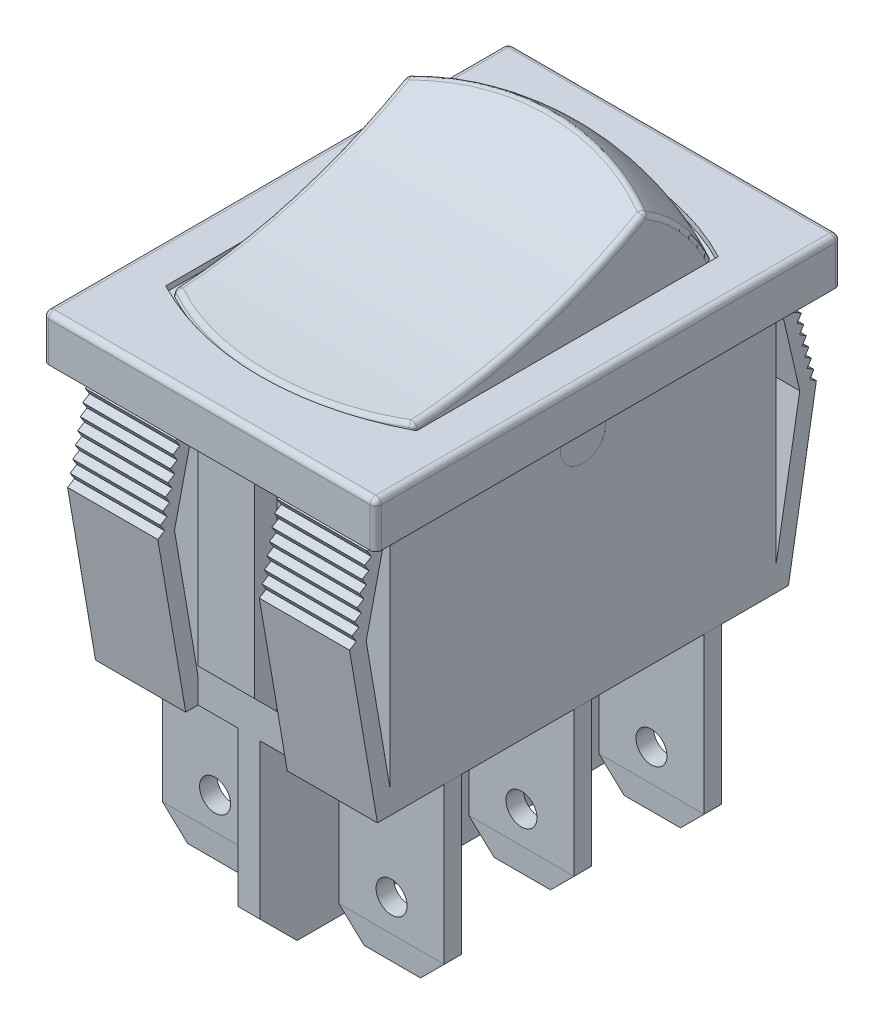
from build123d import *

# Parameters (mm, degrees)
SKETCH1_W             = 14.986
SKETCH1_H             = 20.955
BOSS_EXTRUDE1_DEPTH   = 2.032
SKETCH2_W             = 12.7
SKETCH2_H             = 17.399
BOSS_EXTRUDE2_DEPTH   = 11.684
BOSS_EXTRUDE4_DEPTH   = 4.064
CUT_EXTRUDE1_REACH    = 22.946
LPATTERN1_COUNT       = 8
LPATTERN1_PITCH       = 0.508
MIRROR2_COPY_1_REACH  = 22.946
MIRROR2_COPY_2_REACH  = 22.946
MIRROR2_COPY_3_REACH  = 22.946
MIRROR2_COPY_4_REACH  = 22.946
MIRROR2_COPY_5_REACH  = 22.946
MIRROR2_COPY_6_REACH  = 22.946
MIRROR2_COPY_7_REACH  = 22.946
BOSS_EXTRUDE5_DEPTH   = 1.27
MIRROR3_COPY_1_REACH  = 22.946
MIRROR3_COPY_2_REACH  = 22.946
MIRROR3_COPY_3_REACH  = 22.946
MIRROR3_COPY_4_REACH  = 22.946
MIRROR3_COPY_5_REACH  = 22.946
MIRROR3_COPY_6_REACH  = 22.946
MIRROR3_COPY_7_REACH  = 22.946
MIRROR3_COPY_8_DEPTH  = 4.064
MIRROR3_COPY_9_REACH  = 22.946
MIRROR3_COPY_10_REACH = 22.946
MIRROR3_COPY_11_REACH = 22.946
MIRROR3_COPY_12_REACH = 22.946
MIRROR3_COPY_13_REACH = 22.946
MIRROR3_COPY_14_REACH = 22.946
MIRROR3_COPY_15_REACH = 22.946
MIRROR3_COPY_16_REACH = 22.946
SKETCH9_W             = 0.9906
SKETCH9_H             = 17.399
BOSS_EXTRUDE6_DEPTH   = 8.636
CUT_EXTRUDE2_REACH    = 26.234
SKETCH11_W            = 4.7498
SKETCH11_H            = 0.7874
BOSS_EXTRUDE7_DEPTH   = 8.128
CUT_EXTRUDE3_REACH    = 28.913
SKETCH12_R            = 0.6985
SKETCH13_W            = 4.7498
SKETCH13_H            = 0.7874
BOSS_EXTRUDE8_DEPTH   = 7.62
CUT_EXTRUDE4_REACH    = 26.25
SKETCH14_R            = 0.6985
CUT_EXTRUDE5_REACH    = 28.742
CUT_EXTRUDE6_DEPTH    = 0.254
SKETCH18_R            = 1.016
CUT_EXTRUDE7_DEPTH    = 12.7
CUT_EXTRUDE8_DEPTH    = 10.795
FILLET2_R             = 0.254
FILLET3_R             = 0.254
SKETCH22_W            = 12.4968
SKETCH22_H            = 7.0231
CUT_EXTRUDE9_DEPTH    = 0.00254


# Read off the part's stored shape, not the designer's step: Mirror5
with BuildPart() as part:
    # Sketch1 → Boss-Extrude1 (new body)
    with BuildSketch(Plane(origin=(0, 0, 0), x_dir=(1, 0, 0), z_dir=(0, 1, 0))):
        Rectangle(SKETCH1_W, SKETCH1_H)
    extrude(amount=BOSS_EXTRUDE1_DEPTH)

    # Sketch2 → Boss-Extrude2 (add)
    with BuildSketch(Plane.XZ):
        Rectangle(SKETCH2_W, SKETCH2_H)
    extrude(amount=BOSS_EXTRUDE2_DEPTH)

    # Sketch5 → Boss-Extrude4 (add)
    with BuildSketch(Plane(origin=(6.35, 0, 0), x_dir=(0, 0, -1), z_dir=(1, 0, 0))):
        Polygon((-9.525, 0), (-10.5156, -4.318), (-9.2583, -11.684), (-8.6995, -11.684), (-8.6995, -10.579929775), (-9.764728233, -4.339198711), (-8.769265, 0), align=None)
    boss_extrude4 = extrude(amount=-BOSS_EXTRUDE4_DEPTH)

    # Sketch6 → Cut-Extrude1 (cut, up to next)
    with BuildSketch(Plane(origin=(6.35, 0, 0), x_dir=(0, 0, -1), z_dir=(1, 0, 0)), mode=Mode.PRIVATE) as cut_extrude1_sk1:
        Polygon((-10.5156, -4.318), (-10.211236016, -4.127226403), (-10.402009614, -3.822862419), align=None)
    cut_extrude1_tool1 = extrude(cut_extrude1_sk1.sketch, amount=-CUT_EXTRUDE1_REACH, mode=Mode.PRIVATE) & part.part
    cut_extrude1 = cut_extrude1_tool1.solids().sort_by_distance((6.35, -4.089363, 10.376282))[0]
    add(cut_extrude1, mode=Mode.SUBTRACT)

    # LPattern1: Cut-Extrude1 ×8
    with Locations(*[Vector(0, 0.9746802776302901, -0.22360312251518483) * (i * LPATTERN1_PITCH) for i in range(1, LPATTERN1_COUNT)]):
        add(cut_extrude1, mode=Mode.SUBTRACT)

    # Mirror2: Boss-Extrude4, Cut-Extrude1 across plane
    add(boss_extrude4.mirror(Plane(origin=(0, 0, 0), x_dir=(0, 0, 1), z_dir=(1, 0, 0))))
    add(cut_extrude1.mirror(Plane(origin=(0, 0, 0), x_dir=(0, 0, 1), z_dir=(1, 0, 0))), mode=Mode.SUBTRACT)

    # Mirror2 copy 1 sketch → Mirror2 copy 1 (cut, up to next)
    with BuildSketch(Plane(origin=(-6.35, 0.495137581, -0.113590386), x_dir=(0, 0, -1), z_dir=(-1, 0, 0)), mode=Mode.PRIVATE) as mirror2_copy_1_sk1:
        Polygon((-10.5156, 4.318), (-10.211236016, 4.127226403), (-10.402009614, 3.822862419), align=None)
    mirror2_copy_1_tool1 = extrude(mirror2_copy_1_sk1.sketch, amount=-MIRROR2_COPY_1_REACH, mode=Mode.PRIVATE) & part.part
    add(mirror2_copy_1_tool1.solids().sort_by_distance((-6.35, -3.594225419, 10.262691614))[0], mode=Mode.SUBTRACT)

    # Mirror2 copy 2 sketch → Mirror2 copy 2 (cut, up to next)
    with BuildSketch(Plane(origin=(-6.35, 0.990275162, -0.227180772), x_dir=(0, 0, -1), z_dir=(-1, 0, 0)), mode=Mode.PRIVATE) as mirror2_copy_2_sk1:
        Polygon((-10.5156, 4.318), (-10.211236016, 4.127226403), (-10.402009614, 3.822862419), align=None)
    mirror2_copy_2_tool1 = extrude(mirror2_copy_2_sk1.sketch, amount=-MIRROR2_COPY_2_REACH, mode=Mode.PRIVATE) & part.part
    add(mirror2_copy_2_tool1.solids().sort_by_distance((-6.35, -3.099087838, 10.149101228))[0], mode=Mode.SUBTRACT)

    # Mirror2 copy 3 sketch → Mirror2 copy 3 (cut, up to next)
    with BuildSketch(Plane(origin=(-6.35, 1.485412743, -0.340771159), x_dir=(0, 0, -1), z_dir=(-1, 0, 0)), mode=Mode.PRIVATE) as mirror2_copy_3_sk1:
        Polygon((-10.5156, 4.318), (-10.211236016, 4.127226403), (-10.402009614, 3.822862419), align=None)
    mirror2_copy_3_tool1 = extrude(mirror2_copy_3_sk1.sketch, amount=-MIRROR2_COPY_3_REACH, mode=Mode.PRIVATE) & part.part
    add(mirror2_copy_3_tool1.solids().sort_by_distance((-6.35, -2.603950257, 10.035510841))[0], mode=Mode.SUBTRACT)

    # Mirror2 copy 4 sketch → Mirror2 copy 4 (cut, up to next)
    with BuildSketch(Plane(origin=(-6.35, 1.980550324, -0.454361545), x_dir=(0, 0, -1), z_dir=(-1, 0, 0)), mode=Mode.PRIVATE) as mirror2_copy_4_sk1:
        Polygon((-10.5156, 4.318), (-10.211236016, 4.127226403), (-10.402009614, 3.822862419), align=None)
    mirror2_copy_4_tool1 = extrude(mirror2_copy_4_sk1.sketch, amount=-MIRROR2_COPY_4_REACH, mode=Mode.PRIVATE) & part.part
    add(mirror2_copy_4_tool1.solids().sort_by_distance((-6.35, -2.108812676, 9.921920455))[0], mode=Mode.SUBTRACT)

    # Mirror2 copy 5 sketch → Mirror2 copy 5 (cut, up to next)
    with BuildSketch(Plane(origin=(-6.35, 2.475687905, -0.567951931), x_dir=(0, 0, -1), z_dir=(-1, 0, 0)), mode=Mode.PRIVATE) as mirror2_copy_5_sk1:
        Polygon((-10.5156, 4.318), (-10.211236016, 4.127226403), (-10.402009614, 3.822862419), align=None)
    mirror2_copy_5_tool1 = extrude(mirror2_copy_5_sk1.sketch, amount=-MIRROR2_COPY_5_REACH, mode=Mode.PRIVATE) & part.part
    add(mirror2_copy_5_tool1.solids().sort_by_distance((-6.35, -1.613675095, 9.808330069))[0], mode=Mode.SUBTRACT)

    # Mirror2 copy 6 sketch → Mirror2 copy 6 (cut, up to next)
    with BuildSketch(Plane(origin=(-6.35, 2.970825486, -0.681542317), x_dir=(0, 0, -1), z_dir=(-1, 0, 0)), mode=Mode.PRIVATE) as mirror2_copy_6_sk1:
        Polygon((-10.5156, 4.318), (-10.211236016, 4.127226403), (-10.402009614, 3.822862419), align=None)
    mirror2_copy_6_tool1 = extrude(mirror2_copy_6_sk1.sketch, amount=-MIRROR2_COPY_6_REACH, mode=Mode.PRIVATE) & part.part
    add(mirror2_copy_6_tool1.solids().sort_by_distance((-6.35, -1.118537514, 9.694739683))[0], mode=Mode.SUBTRACT)

    # Mirror2 copy 7 sketch → Mirror2 copy 7 (cut, up to next)
    with BuildSketch(Plane(origin=(-6.35, 3.465963067, -0.795132704), x_dir=(0, 0, -1), z_dir=(-1, 0, 0)), mode=Mode.PRIVATE) as mirror2_copy_7_sk1:
        Polygon((-10.5156, 4.318), (-10.211236016, 4.127226403), (-10.402009614, 3.822862419), align=None)
    mirror2_copy_7_tool1 = extrude(mirror2_copy_7_sk1.sketch, amount=-MIRROR2_COPY_7_REACH, mode=Mode.PRIVATE) & part.part
    add(mirror2_copy_7_tool1.solids().sort_by_distance((-6.35, -0.623399933, 9.581149296))[0], mode=Mode.SUBTRACT)

    # Sketch8 → Boss-Extrude5 (add, symmetric)
    with BuildSketch(Plane(origin=(0, 0, 0), x_dir=(0, 0, -1), z_dir=(1, 0, 0))):
        Polygon((-9.7155, 0), (-8.6995, 0), (-8.6995, -10.16), (-9.7155, -9.144), align=None)
    boss_extrude5 = extrude(amount=BOSS_EXTRUDE5_DEPTH, both=True)

    # Mirror3: Boss-Extrude4, Cut-Extrude1, Boss-Extrude5 across plane
    add(boss_extrude4.mirror(Plane.XY))
    add(cut_extrude1.mirror(Plane.XY), mode=Mode.SUBTRACT)
    add(boss_extrude5.mirror(Plane.XY))

    # Mirror3 copy 1 sketch → Mirror3 copy 1 (cut, up to next)
    with BuildSketch(Plane(origin=(6.35, 0.495137581, 0.113590386), x_dir=(0, 0, 1), z_dir=(1, 0, 0)), mode=Mode.PRIVATE) as mirror3_copy_1_sk1:
        Polygon((-10.5156, 4.318), (-10.211236016, 4.127226403), (-10.402009614, 3.822862419), align=None)
    mirror3_copy_1_tool1 = extrude(mirror3_copy_1_sk1.sketch, amount=-MIRROR3_COPY_1_REACH, mode=Mode.PRIVATE) & part.part
    add(mirror3_copy_1_tool1.solids().sort_by_distance((6.35, -3.594225419, -10.262691614))[0], mode=Mode.SUBTRACT)

    # Mirror3 copy 2 sketch → Mirror3 copy 2 (cut, up to next)
    with BuildSketch(Plane(origin=(6.35, 0.990275162, 0.227180772), x_dir=(0, 0, 1), z_dir=(1, 0, 0)), mode=Mode.PRIVATE) as mirror3_copy_2_sk1:
        Polygon((-10.5156, 4.318), (-10.211236016, 4.127226403), (-10.402009614, 3.822862419), align=None)
    mirror3_copy_2_tool1 = extrude(mirror3_copy_2_sk1.sketch, amount=-MIRROR3_COPY_2_REACH, mode=Mode.PRIVATE) & part.part
    add(mirror3_copy_2_tool1.solids().sort_by_distance((6.35, -3.099087838, -10.149101228))[0], mode=Mode.SUBTRACT)

    # Mirror3 copy 3 sketch → Mirror3 copy 3 (cut, up to next)
    with BuildSketch(Plane(origin=(6.35, 1.485412743, 0.340771159), x_dir=(0, 0, 1), z_dir=(1, 0, 0)), mode=Mode.PRIVATE) as mirror3_copy_3_sk1:
        Polygon((-10.5156, 4.318), (-10.211236016, 4.127226403), (-10.402009614, 3.822862419), align=None)
    mirror3_copy_3_tool1 = extrude(mirror3_copy_3_sk1.sketch, amount=-MIRROR3_COPY_3_REACH, mode=Mode.PRIVATE) & part.part
    add(mirror3_copy_3_tool1.solids().sort_by_distance((6.35, -2.603950257, -10.035510841))[0], mode=Mode.SUBTRACT)

    # Mirror3 copy 4 sketch → Mirror3 copy 4 (cut, up to next)
    with BuildSketch(Plane(origin=(6.35, 1.980550324, 0.454361545), x_dir=(0, 0, 1), z_dir=(1, 0, 0)), mode=Mode.PRIVATE) as mirror3_copy_4_sk1:
        Polygon((-10.5156, 4.318), (-10.211236016, 4.127226403), (-10.402009614, 3.822862419), align=None)
    mirror3_copy_4_tool1 = extrude(mirror3_copy_4_sk1.sketch, amount=-MIRROR3_COPY_4_REACH, mode=Mode.PRIVATE) & part.part
    add(mirror3_copy_4_tool1.solids().sort_by_distance((6.35, -2.108812676, -9.921920455))[0], mode=Mode.SUBTRACT)

    # Mirror3 copy 5 sketch → Mirror3 copy 5 (cut, up to next)
    with BuildSketch(Plane(origin=(6.35, 2.475687905, 0.567951931), x_dir=(0, 0, 1), z_dir=(1, 0, 0)), mode=Mode.PRIVATE) as mirror3_copy_5_sk1:
        Polygon((-10.5156, 4.318), (-10.211236016, 4.127226403), (-10.402009614, 3.822862419), align=None)
    mirror3_copy_5_tool1 = extrude(mirror3_copy_5_sk1.sketch, amount=-MIRROR3_COPY_5_REACH, mode=Mode.PRIVATE) & part.part
    add(mirror3_copy_5_tool1.solids().sort_by_distance((6.35, -1.613675095, -9.808330069))[0], mode=Mode.SUBTRACT)

    # Mirror3 copy 6 sketch → Mirror3 copy 6 (cut, up to next)
    with BuildSketch(Plane(origin=(6.35, 2.970825486, 0.681542317), x_dir=(0, 0, 1), z_dir=(1, 0, 0)), mode=Mode.PRIVATE) as mirror3_copy_6_sk1:
        Polygon((-10.5156, 4.318), (-10.211236016, 4.127226403), (-10.402009614, 3.822862419), align=None)
    mirror3_copy_6_tool1 = extrude(mirror3_copy_6_sk1.sketch, amount=-MIRROR3_COPY_6_REACH, mode=Mode.PRIVATE) & part.part
    add(mirror3_copy_6_tool1.solids().sort_by_distance((6.35, -1.118537514, -9.694739683))[0], mode=Mode.SUBTRACT)

    # Mirror3 copy 7 sketch → Mirror3 copy 7 (cut, up to next)
    with BuildSketch(Plane(origin=(6.35, 3.465963067, 0.795132704), x_dir=(0, 0, 1), z_dir=(1, 0, 0)), mode=Mode.PRIVATE) as mirror3_copy_7_sk1:
        Polygon((-10.5156, 4.318), (-10.211236016, 4.127226403), (-10.402009614, 3.822862419), align=None)
    mirror3_copy_7_tool1 = extrude(mirror3_copy_7_sk1.sketch, amount=-MIRROR3_COPY_7_REACH, mode=Mode.PRIVATE) & part.part
    add(mirror3_copy_7_tool1.solids().sort_by_distance((6.35, -0.623399933, -9.581149296))[0], mode=Mode.SUBTRACT)

    # Mirror3 copy 8 sketch → Mirror3 copy 8 (add)
    with BuildSketch(Plane.ZY.offset(6.35)):
        Polygon((-9.525, 0), (-10.5156, -4.318), (-9.2583, -11.684), (-8.6995, -11.684), (-8.6995, -10.579929775), (-9.764728233, -4.339198711), (-8.769265, 0), align=None)
    extrude(amount=-MIRROR3_COPY_8_DEPTH)

    # Mirror3 copy 9 sketch → Mirror3 copy 9 (cut, up to next)
    with BuildSketch(Plane.ZY.offset(6.35), mode=Mode.PRIVATE) as mirror3_copy_9_sk1:
        Polygon((-10.5156, -4.318), (-10.211236016, -4.127226403), (-10.402009614, -3.822862419), align=None)
    mirror3_copy_9_tool1 = extrude(mirror3_copy_9_sk1.sketch, amount=-MIRROR3_COPY_9_REACH, mode=Mode.PRIVATE) & part.part
    add(mirror3_copy_9_tool1.solids().sort_by_distance((-6.35, -4.089363, -10.376282))[0], mode=Mode.SUBTRACT)

    # Mirror3 copy 10 sketch → Mirror3 copy 10 (cut, up to next)
    with BuildSketch(Plane(origin=(-6.35, 0.495137581, 0.113590386), x_dir=(0, 0, 1), z_dir=(-1, 0, 0)), mode=Mode.PRIVATE) as mirror3_copy_10_sk1:
        Polygon((-10.5156, -4.318), (-10.211236016, -4.127226403), (-10.402009614, -3.822862419), align=None)
    mirror3_copy_10_tool1 = extrude(mirror3_copy_10_sk1.sketch, amount=-MIRROR3_COPY_10_REACH, mode=Mode.PRIVATE) & part.part
    add(mirror3_copy_10_tool1.solids().sort_by_distance((-6.35, -3.594225419, -10.262691614))[0], mode=Mode.SUBTRACT)

    # Mirror3 copy 11 sketch → Mirror3 copy 11 (cut, up to next)
    with BuildSketch(Plane(origin=(-6.35, 0.990275162, 0.227180772), x_dir=(0, 0, 1), z_dir=(-1, 0, 0)), mode=Mode.PRIVATE) as mirror3_copy_11_sk1:
        Polygon((-10.5156, -4.318), (-10.211236016, -4.127226403), (-10.402009614, -3.822862419), align=None)
    mirror3_copy_11_tool1 = extrude(mirror3_copy_11_sk1.sketch, amount=-MIRROR3_COPY_11_REACH, mode=Mode.PRIVATE) & part.part
    add(mirror3_copy_11_tool1.solids().sort_by_distance((-6.35, -3.099087838, -10.149101228))[0], mode=Mode.SUBTRACT)

    # Mirror3 copy 12 sketch → Mirror3 copy 12 (cut, up to next)
    with BuildSketch(Plane(origin=(-6.35, 1.485412743, 0.340771159), x_dir=(0, 0, 1), z_dir=(-1, 0, 0)), mode=Mode.PRIVATE) as mirror3_copy_12_sk1:
        Polygon((-10.5156, -4.318), (-10.211236016, -4.127226403), (-10.402009614, -3.822862419), align=None)
    mirror3_copy_12_tool1 = extrude(mirror3_copy_12_sk1.sketch, amount=-MIRROR3_COPY_12_REACH, mode=Mode.PRIVATE) & part.part
    add(mirror3_copy_12_tool1.solids().sort_by_distance((-6.35, -2.603950257, -10.035510841))[0], mode=Mode.SUBTRACT)

    # Mirror3 copy 13 sketch → Mirror3 copy 13 (cut, up to next)
    with BuildSketch(Plane(origin=(-6.35, 1.980550324, 0.454361545), x_dir=(0, 0, 1), z_dir=(-1, 0, 0)), mode=Mode.PRIVATE) as mirror3_copy_13_sk1:
        Polygon((-10.5156, -4.318), (-10.211236016, -4.127226403), (-10.402009614, -3.822862419), align=None)
    mirror3_copy_13_tool1 = extrude(mirror3_copy_13_sk1.sketch, amount=-MIRROR3_COPY_13_REACH, mode=Mode.PRIVATE) & part.part
    add(mirror3_copy_13_tool1.solids().sort_by_distance((-6.35, -2.108812676, -9.921920455))[0], mode=Mode.SUBTRACT)

    # Mirror3 copy 14 sketch → Mirror3 copy 14 (cut, up to next)
    with BuildSketch(Plane(origin=(-6.35, 2.475687905, 0.567951931), x_dir=(0, 0, 1), z_dir=(-1, 0, 0)), mode=Mode.PRIVATE) as mirror3_copy_14_sk1:
        Polygon((-10.5156, -4.318), (-10.211236016, -4.127226403), (-10.402009614, -3.822862419), align=None)
    mirror3_copy_14_tool1 = extrude(mirror3_copy_14_sk1.sketch, amount=-MIRROR3_COPY_14_REACH, mode=Mode.PRIVATE) & part.part
    add(mirror3_copy_14_tool1.solids().sort_by_distance((-6.35, -1.613675095, -9.808330069))[0], mode=Mode.SUBTRACT)

    # Mirror3 copy 15 sketch → Mirror3 copy 15 (cut, up to next)
    with BuildSketch(Plane(origin=(-6.35, 2.970825486, 0.681542317), x_dir=(0, 0, 1), z_dir=(-1, 0, 0)), mode=Mode.PRIVATE) as mirror3_copy_15_sk1:
        Polygon((-10.5156, -4.318), (-10.211236016, -4.127226403), (-10.402009614, -3.822862419), align=None)
    mirror3_copy_15_tool1 = extrude(mirror3_copy_15_sk1.sketch, amount=-MIRROR3_COPY_15_REACH, mode=Mode.PRIVATE) & part.part
    add(mirror3_copy_15_tool1.solids().sort_by_distance((-6.35, -1.118537514, -9.694739683))[0], mode=Mode.SUBTRACT)

    # Mirror3 copy 16 sketch → Mirror3 copy 16 (cut, up to next)
    with BuildSketch(Plane(origin=(-6.35, 3.465963067, 0.795132704), x_dir=(0, 0, 1), z_dir=(-1, 0, 0)), mode=Mode.PRIVATE) as mirror3_copy_16_sk1:
        Polygon((-10.5156, -4.318), (-10.211236016, -4.127226403), (-10.402009614, -3.822862419), align=None)
    mirror3_copy_16_tool1 = extrude(mirror3_copy_16_sk1.sketch, amount=-MIRROR3_COPY_16_REACH, mode=Mode.PRIVATE) & part.part
    add(mirror3_copy_16_tool1.solids().sort_by_distance((-6.35, -0.623399933, -9.581149296))[0], mode=Mode.SUBTRACT)

    # Sketch9 → Boss-Extrude6 (add)
    with BuildSketch(Plane.XZ.offset(11.684)):
        Rectangle(SKETCH9_W, SKETCH9_H)
    extrude(amount=BOSS_EXTRUDE6_DEPTH)

    # Sketch10 → Cut-Extrude2 (cut, up to next)
    with BuildSketch(Plane(origin=(0.4953, 0, 0), x_dir=(0, 0, -1), z_dir=(1, 0, 0)), mode=Mode.PRIVATE) as cut_extrude2_sk1:
        Polygon((-8.6995, -18.6436), (-8.6995, -20.32), (-7.0231, -20.32), align=None)
    cut_extrude2_tool1 = extrude(cut_extrude2_sk1.sketch, amount=-CUT_EXTRUDE2_REACH, mode=Mode.PRIVATE) & part.part
    # Sketch10 → Cut-Extrude2 (cut, up to next)
    with BuildSketch(Plane(origin=(0.4953, 0, 0), x_dir=(0, 0, -1), z_dir=(1, 0, 0)), mode=Mode.PRIVATE) as cut_extrude2_sk2:
        Polygon((7.0231, -20.32), (8.6995, -18.6436), (8.6995, -20.32), align=None)
    cut_extrude2_tool2 = extrude(cut_extrude2_sk2.sketch, amount=-CUT_EXTRUDE2_REACH, mode=Mode.PRIVATE) & part.part
    add(cut_extrude2_tool1.solids().sort_by_distance((0.4953, -19.7612, 8.1407))[0], mode=Mode.SUBTRACT)
    add(cut_extrude2_tool2.solids().sort_by_distance((0.4953, -19.7612, -8.1407))[0], mode=Mode.SUBTRACT)

    # Sketch11 → Boss-Extrude7 (add)
    with BuildSketch(Plane.XZ.offset(11.684)):
        with Locations((3.9751, 5.8547)):
            Rectangle(SKETCH11_W, SKETCH11_H)
    boss_extrude7 = extrude(amount=BOSS_EXTRUDE7_DEPTH)

    # Sketch12 → Cut-Extrude3 (cut, up to next)
    with BuildSketch(Plane(origin=(0, 0, 5.461), x_dir=(-1, 0, 0), z_dir=(0, 0, -1)), mode=Mode.PRIVATE) as cut_extrude3_sk1:
        with Locations((-3.9751, -17.272)):
            Circle(SKETCH12_R)
    cut_extrude3_tool1 = extrude(cut_extrude3_sk1.sketch, amount=-CUT_EXTRUDE3_REACH, mode=Mode.PRIVATE) & part.part
    # Sketch12 → Cut-Extrude3 (cut, up to next)
    with BuildSketch(Plane(origin=(0, 0, 5.461), x_dir=(-1, 0, 0), z_dir=(0, 0, -1)), mode=Mode.PRIVATE) as cut_extrude3_sk2:
        Polygon((-1.6002, -18.7071), (-2.7051, -19.812), (-1.6002, -19.812), align=None)
    cut_extrude3_tool2 = extrude(cut_extrude3_sk2.sketch, amount=-CUT_EXTRUDE3_REACH, mode=Mode.PRIVATE) & part.part
    # Sketch12 → Cut-Extrude3 (cut, up to next)
    with BuildSketch(Plane(origin=(0, 0, 5.461), x_dir=(-1, 0, 0), z_dir=(0, 0, -1)), mode=Mode.PRIVATE) as cut_extrude3_sk3:
        Polygon((-5.2451, -19.812), (-6.35, -19.812), (-6.35, -18.7071), align=None)
    cut_extrude3_tool3 = extrude(cut_extrude3_sk3.sketch, amount=-CUT_EXTRUDE3_REACH, mode=Mode.PRIVATE) & part.part
    cut_extrude3_1 = cut_extrude3_tool1.solids().sort_by_distance((3.9751, -17.272, 5.461))[0]
    add(cut_extrude3_1, mode=Mode.SUBTRACT)
    cut_extrude3_2 = cut_extrude3_tool2.solids().sort_by_distance((1.9685, -19.4437, 5.461))[0]
    add(cut_extrude3_2, mode=Mode.SUBTRACT)
    cut_extrude3_3 = cut_extrude3_tool3.solids().sort_by_distance((5.9817, -19.4437, 5.461))[0]
    add(cut_extrude3_3, mode=Mode.SUBTRACT)
    cut_extrude3 = cut_extrude3_1 + cut_extrude3_2 + cut_extrude3_3  # Cut-Extrude3 as one shape, for the pattern or mirror that repeats it

    # Mirror4: Boss-Extrude7, Cut-Extrude3 across plane
    add(boss_extrude7.mirror(Plane.XY))
    add(cut_extrude3.mirror(Plane.XY), mode=Mode.SUBTRACT)

    # Sketch13 → Boss-Extrude8 (add)
    with BuildSketch(Plane.XZ.offset(11.684)):
        with Locations((3.9751, 0)):
            Rectangle(SKETCH13_W, SKETCH13_H)
    extrude(amount=BOSS_EXTRUDE8_DEPTH)

    # Sketch14 → Cut-Extrude4 (cut, up to next)
    with BuildSketch(Plane(origin=(0, 0, -0.3937), x_dir=(-1, 0, 0), z_dir=(0, 0, -1)), mode=Mode.PRIVATE) as cut_extrude4_sk1:
        with Locations((-3.9751, -16.764)):
            Circle(SKETCH14_R)
    cut_extrude4_tool1 = extrude(cut_extrude4_sk1.sketch, amount=-CUT_EXTRUDE4_REACH, mode=Mode.PRIVATE) & part.part
    # Sketch14 → Cut-Extrude4 (cut, up to next)
    with BuildSketch(Plane(origin=(0, 0, -0.3937), x_dir=(-1, 0, 0), z_dir=(0, 0, -1)), mode=Mode.PRIVATE) as cut_extrude4_sk2:
        Polygon((-5.2451, -19.304), (-6.35, -19.304), (-6.35, -18.1991), align=None)
    cut_extrude4_tool2 = extrude(cut_extrude4_sk2.sketch, amount=-CUT_EXTRUDE4_REACH, mode=Mode.PRIVATE) & part.part
    # Sketch14 → Cut-Extrude4 (cut, up to next)
    with BuildSketch(Plane(origin=(0, 0, -0.3937), x_dir=(-1, 0, 0), z_dir=(0, 0, -1)), mode=Mode.PRIVATE) as cut_extrude4_sk3:
        Polygon((-1.6002, -18.1991), (-2.7051, -19.304), (-1.6002, -19.304), align=None)
    cut_extrude4_tool3 = extrude(cut_extrude4_sk3.sketch, amount=-CUT_EXTRUDE4_REACH, mode=Mode.PRIVATE) & part.part
    add(cut_extrude4_tool1.solids().sort_by_distance((3.9751, -16.764, -0.3937))[0], mode=Mode.SUBTRACT)
    add(cut_extrude4_tool2.solids().sort_by_distance((5.9817, -18.9357, -0.3937))[0], mode=Mode.SUBTRACT)
    add(cut_extrude4_tool3.solids().sort_by_distance((1.9685, -18.9357, -0.3937))[0], mode=Mode.SUBTRACT)

    # Cut-Extrude5: up to this face of the body (flat: up to its plane)
    cut_extrude5_end = Plane(part.part.faces().sort_by_distance((1.6002, -15.19555, -5.8547))[0])
    # Sketch15 → Cut-Extrude5 (cut, up to the picked face)
    with BuildSketch(Plane(origin=(6.35, 0, 0), x_dir=(0, 0, -1), z_dir=(1, 0, 0)), mode=Mode.PRIVATE) as cut_extrude5_sk1:
        Polygon((6.2484, -18.7071), (6.2103, -19.812), (6.2484, -19.812), align=None)
    cut_extrude5_tool1 = split(extrude(cut_extrude5_sk1.sketch, amount=-CUT_EXTRUDE5_REACH, mode=Mode.PRIVATE), bisect_by=cut_extrude5_end, keep=Keep.BOTH, mode=Mode.PRIVATE)
    # Sketch15 → Cut-Extrude5 (cut, up to the picked face)
    with BuildSketch(Plane(origin=(6.35, 0, 0), x_dir=(0, 0, -1), z_dir=(1, 0, 0)), mode=Mode.PRIVATE) as cut_extrude5_sk2:
        Polygon((0.3937, -18.1991), (0.3556, -19.304), (0.3937, -19.304), align=None)
    cut_extrude5_tool2 = split(extrude(cut_extrude5_sk2.sketch, amount=-CUT_EXTRUDE5_REACH, mode=Mode.PRIVATE), bisect_by=cut_extrude5_end, keep=Keep.BOTH, mode=Mode.PRIVATE)
    # Sketch15 → Cut-Extrude5 (cut, up to the picked face)
    with BuildSketch(Plane(origin=(6.35, 0, 0), x_dir=(0, 0, -1), z_dir=(1, 0, 0)), mode=Mode.PRIVATE) as cut_extrude5_sk3:
        Polygon((-5.461, -18.7071), (-5.4991, -19.812), (-5.461, -19.812), align=None)
    cut_extrude5_tool3 = split(extrude(cut_extrude5_sk3.sketch, amount=-CUT_EXTRUDE5_REACH, mode=Mode.PRIVATE), bisect_by=cut_extrude5_end, keep=Keep.BOTH, mode=Mode.PRIVATE)
    # Sketch15 → Cut-Extrude5 (cut, up to the picked face)
    with BuildSketch(Plane(origin=(6.35, 0, 0), x_dir=(0, 0, -1), z_dir=(1, 0, 0)), mode=Mode.PRIVATE) as cut_extrude5_sk4:
        Polygon((5.461, -19.812), (5.461, -18.7071), (5.4991, -19.812), align=None)
    cut_extrude5_tool4 = split(extrude(cut_extrude5_sk4.sketch, amount=-CUT_EXTRUDE5_REACH, mode=Mode.PRIVATE), bisect_by=cut_extrude5_end, keep=Keep.BOTH, mode=Mode.PRIVATE)
    # Sketch15 → Cut-Extrude5 (cut, up to the picked face)
    with BuildSketch(Plane(origin=(6.35, 0, 0), x_dir=(0, 0, -1), z_dir=(1, 0, 0)), mode=Mode.PRIVATE) as cut_extrude5_sk5:
        Polygon((-0.3937, -19.304), (-0.3937, -18.1991), (-0.3556, -19.304), align=None)
    cut_extrude5_tool5 = split(extrude(cut_extrude5_sk5.sketch, amount=-CUT_EXTRUDE5_REACH, mode=Mode.PRIVATE), bisect_by=cut_extrude5_end, keep=Keep.BOTH, mode=Mode.PRIVATE)
    # Sketch15 → Cut-Extrude5 (cut, up to the picked face)
    with BuildSketch(Plane(origin=(6.35, 0, 0), x_dir=(0, 0, -1), z_dir=(1, 0, 0)), mode=Mode.PRIVATE) as cut_extrude5_sk6:
        Polygon((-6.2484, -19.812), (-6.2484, -18.7071), (-6.2103, -19.812), align=None)
    cut_extrude5_tool6 = split(extrude(cut_extrude5_sk6.sketch, amount=-CUT_EXTRUDE5_REACH, mode=Mode.PRIVATE), bisect_by=cut_extrude5_end, keep=Keep.BOTH, mode=Mode.PRIVATE)
    add(cut_extrude5_tool1.solids().sort_by(Axis((6.35, -19.4437, -6.2357), (-1, 0, 0)))[0], mode=Mode.SUBTRACT)
    add(cut_extrude5_tool2.solids().sort_by(Axis((6.35, -18.9357, -0.381), (-1, 0, 0)))[0], mode=Mode.SUBTRACT)
    add(cut_extrude5_tool3.solids().sort_by(Axis((6.35, -19.4437, 5.4737), (-1, 0, 0)))[0], mode=Mode.SUBTRACT)
    add(cut_extrude5_tool4.solids().sort_by(Axis((6.35, -19.4437, -5.4737), (-1, 0, 0)))[0], mode=Mode.SUBTRACT)
    add(cut_extrude5_tool5.solids().sort_by(Axis((6.35, -18.9357, 0.381), (-1, 0, 0)))[0], mode=Mode.SUBTRACT)
    add(cut_extrude5_tool6.solids().sort_by(Axis((6.35, -19.4437, 6.2357), (-1, 0, 0)))[0], mode=Mode.SUBTRACT)

    # Mirror5: part across plane


with BuildPart() as part_1:
    add(part.part)
    add(part.part.mirror(Plane(origin=(0, 0, 0), x_dir=(0, 0, 1), z_dir=(1, 0, 0))))

    # Sketch16 → Cut-Extrude6 (cut)
    with BuildSketch(Plane(origin=(0, 2.032, 0), x_dir=(1, 0, 0), z_dir=(0, 1, 0))):
        with BuildLine():
            Line((5.6515, 6.7945), (5.6515, -6.7945))
            ThreePointArc((5.6515, -6.7945), (0, -8.1915), (-5.6515, -6.7945))
            Line((-5.6515, -6.7945), (-5.6515, 6.7945))
            ThreePointArc((-5.6515, 6.7945), (0, 8.1915), (5.6515, 6.7945))
        make_face()
    extrude(amount=-CUT_EXTRUDE6_DEPTH, mode=Mode.SUBTRACT)

    # Sketch18 → Cut-Extrude7 (cut)
    with BuildSketch(Plane(origin=(6.35, 0, 0), x_dir=(0, 0, -1), z_dir=(1, 0, 0))):
        with Locations((0, -1.27)):
            Circle(SKETCH18_R)
    extrude(amount=-CUT_EXTRUDE7_DEPTH, mode=Mode.SUBTRACT)

    # Fillet3
    fillet3_edges = [part_1.edges().sort_by_distance(p)[0] for p in [
        (7.493, 2.032, 0),
        (0, 2.032, -10.4775),
        (-7.493, 2.032, 0),
        (0, 2.032, 10.4775),
        (-7.493, 1.016, -10.4775),
        (7.493, 1.016, -10.4775),
        (7.493, 1.016, 10.4775),
        (-7.493, 1.016, 10.4775),
    ]]
    fillet(fillet3_edges, radius=FILLET3_R)

    # Sketch22 → Cut-Extrude9 (cut)
    with BuildSketch(Plane.ZY.offset(6.35)):
        with Locations((0, -15.19555)):
            Rectangle(SKETCH22_W, SKETCH22_H)
    cut_extrude9 = extrude(amount=-CUT_EXTRUDE9_DEPTH, mode=Mode.SUBTRACT)

    # Mirror6: Cut-Extrude9 across plane
    add(cut_extrude9.mirror(Plane(origin=(0, 0, 0), x_dir=(0, 0, 1), z_dir=(1, 0, 0))), mode=Mode.SUBTRACT)


with BuildPart() as body_2:
    # Sketch19 → Revolve1 (revolve)
    with BuildSketch(Plane.XZ.offset(1.27)):
        with BuildLine():
            Line((-6.35, 0), (6.35, 0))
            Line((6.35, 0), (6.35, 1.016))
            Line((6.35, 1.016), (5.3975, 1.016))
            Line((5.3975, 1.016), (5.3975, 7.369081006))
            ThreePointArc((5.3975, 7.369081006), (0, 8.636), (-5.3975, 7.369081006))
            Line((-5.3975, 7.369081006), (-5.3975, 1.016))
            Line((-5.3975, 1.016), (-6.35, 1.016))
            Line((-6.35, 1.016), (-6.35, 0))
        make_face()
    revolve(axis=Axis((-6.35, -1.27, 0), (1, 0, 0)))

    # Sketch21 → Cut-Extrude8 (cut)
    with BuildSketch(Plane(origin=(5.3975, 0, 0), x_dir=(0, 0, -1), z_dir=(1, 0, 0))):
        with BuildLine():
            ThreePointArc((-7.979805261, 2.032), (-1.264541484, 3.004475429), (4.898974587, 5.842))
            ThreePointArc((4.898974587, 5.842), (-2.449878448, 7.011219209), (-7.979805261, 2.032))
        make_face()
    extrude(amount=-CUT_EXTRUDE8_DEPTH, mode=Mode.SUBTRACT)

    # Fillet2
    fillet2_edges = [body_2.edges().sort_by_distance(p)[0] for p in [
        (-5.3975, -7.65344699, -3.681706045),
        (-5.3975, 3.004475429, 1.264541484),
        (5.3975, -7.65344699, -3.681706045),
        (5.3975, 3.004475429, 1.264541484),
        (2.79153971, 2.034657103, 7.625136746),
        (0, 5.842, -4.898974587),
    ]]
    fillet(fillet2_edges, radius=FILLET2_R)


solid = Compound([part_1.part, body_2.part])
